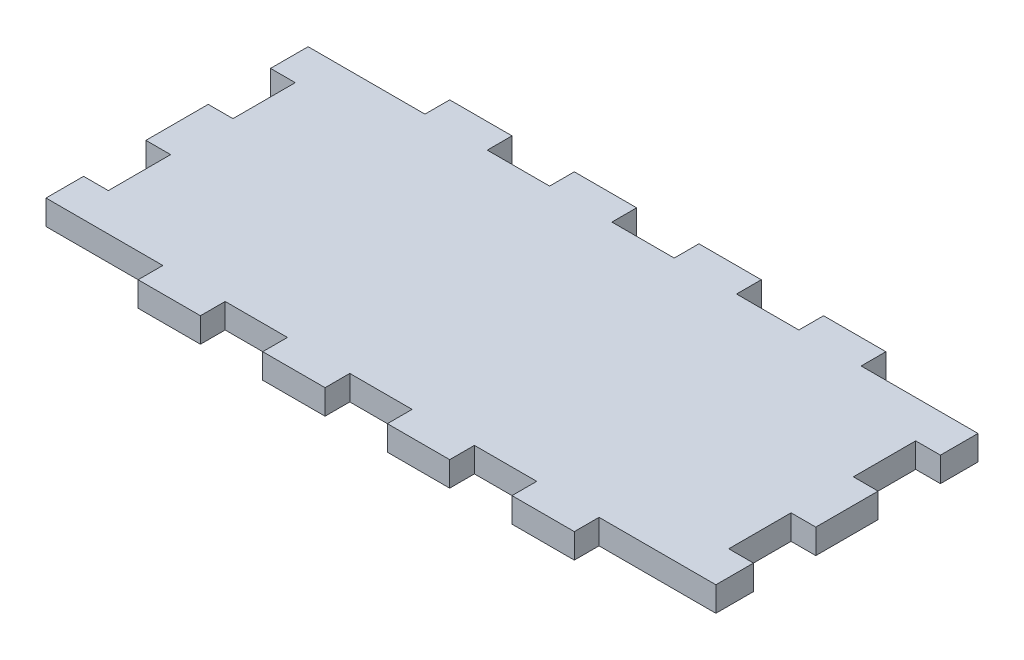
from build123d import *

# Parameters (mm, degrees)
SKETCH1_W           = 86
SKETCH1_H           = 40
BOSS_EXTRUDE1_DEPTH = 3.175
CUT_EXTRUDE1_REACH  = 96.9
SKETCH2_W           = 15
SKETCH2_H           = 3.175
SKETCH2_W_2         = 8
CUT_EXTRUDE2_REACH  = 96.9
SKETCH3_W           = 3.175
SKETCH3_H           = 8


with BuildPart() as part:
    # Sketch1 → Boss-Extrude1 (new body)
    with BuildSketch(Plane(origin=(0, 0, 0), x_dir=(1, 0, 0), z_dir=(0, 1, 0))):
        with Locations((43, -20)):
            Rectangle(SKETCH1_W, SKETCH1_H)
    extrude(amount=BOSS_EXTRUDE1_DEPTH)

    # Sketch2 → Cut-Extrude1 (cut, up to next)
    with BuildSketch(Plane(origin=(0, 3.175, 0), x_dir=(1, 0, 0), z_dir=(0, 1, 0)), mode=Mode.PRIVATE) as cut_extrude1_sk1:
        with Locations((7.5, -1.5875)):
            Rectangle(SKETCH2_W, SKETCH2_H)
    cut_extrude1_tool1 = extrude(cut_extrude1_sk1.sketch, amount=-CUT_EXTRUDE1_REACH, mode=Mode.PRIVATE) & part.part
    # Sketch2 → Cut-Extrude1 (cut, up to next)
    with BuildSketch(Plane(origin=(0, 3.175, 0), x_dir=(1, 0, 0), z_dir=(0, 1, 0)), mode=Mode.PRIVATE) as cut_extrude1_sk2:
        with Locations((43, -1.5875)):
            Rectangle(SKETCH2_W_2, SKETCH2_H)
    cut_extrude1_tool2 = extrude(cut_extrude1_sk2.sketch, amount=-CUT_EXTRUDE1_REACH, mode=Mode.PRIVATE) & part.part
    # Sketch2 → Cut-Extrude1 (cut, up to next)
    with BuildSketch(Plane(origin=(0, 3.175, 0), x_dir=(1, 0, 0), z_dir=(0, 1, 0)), mode=Mode.PRIVATE) as cut_extrude1_sk3:
        with Locations((59, -1.5875)):
            Rectangle(SKETCH2_W_2, SKETCH2_H)
    cut_extrude1_tool3 = extrude(cut_extrude1_sk3.sketch, amount=-CUT_EXTRUDE1_REACH, mode=Mode.PRIVATE) & part.part
    # Sketch2 → Cut-Extrude1 (cut, up to next)
    with BuildSketch(Plane(origin=(0, 3.175, 0), x_dir=(1, 0, 0), z_dir=(0, 1, 0)), mode=Mode.PRIVATE) as cut_extrude1_sk4:
        with Locations((78.5, -1.5875)):
            Rectangle(SKETCH2_W, SKETCH2_H)
    cut_extrude1_tool4 = extrude(cut_extrude1_sk4.sketch, amount=-CUT_EXTRUDE1_REACH, mode=Mode.PRIVATE) & part.part
    # Sketch2 → Cut-Extrude1 (cut, up to next)
    with BuildSketch(Plane(origin=(0, 3.175, 0), x_dir=(1, 0, 0), z_dir=(0, 1, 0)), mode=Mode.PRIVATE) as cut_extrude1_sk5:
        with Locations((27, -1.5875)):
            Rectangle(SKETCH2_W_2, SKETCH2_H)
    cut_extrude1_tool5 = extrude(cut_extrude1_sk5.sketch, amount=-CUT_EXTRUDE1_REACH, mode=Mode.PRIVATE) & part.part
    # Sketch2 → Cut-Extrude1 (cut, up to next)
    with BuildSketch(Plane(origin=(0, 3.175, 0), x_dir=(1, 0, 0), z_dir=(0, 1, 0)), mode=Mode.PRIVATE) as cut_extrude1_sk6:
        with Locations((43, -38.4125)):
            Rectangle(SKETCH2_W_2, SKETCH2_H)
    cut_extrude1_tool6 = extrude(cut_extrude1_sk6.sketch, amount=-CUT_EXTRUDE1_REACH, mode=Mode.PRIVATE) & part.part
    # Sketch2 → Cut-Extrude1 (cut, up to next)
    with BuildSketch(Plane(origin=(0, 3.175, 0), x_dir=(1, 0, 0), z_dir=(0, 1, 0)), mode=Mode.PRIVATE) as cut_extrude1_sk7:
        with Locations((27, -38.4125)):
            Rectangle(SKETCH2_W_2, SKETCH2_H)
    cut_extrude1_tool7 = extrude(cut_extrude1_sk7.sketch, amount=-CUT_EXTRUDE1_REACH, mode=Mode.PRIVATE) & part.part
    # Sketch2 → Cut-Extrude1 (cut, up to next)
    with BuildSketch(Plane(origin=(0, 3.175, 0), x_dir=(1, 0, 0), z_dir=(0, 1, 0)), mode=Mode.PRIVATE) as cut_extrude1_sk8:
        with Locations((7.5, -38.4125)):
            Rectangle(SKETCH2_W, SKETCH2_H)
    cut_extrude1_tool8 = extrude(cut_extrude1_sk8.sketch, amount=-CUT_EXTRUDE1_REACH, mode=Mode.PRIVATE) & part.part
    # Sketch2 → Cut-Extrude1 (cut, up to next)
    with BuildSketch(Plane(origin=(0, 3.175, 0), x_dir=(1, 0, 0), z_dir=(0, 1, 0)), mode=Mode.PRIVATE) as cut_extrude1_sk9:
        with Locations((78.5, -38.4125)):
            Rectangle(SKETCH2_W, SKETCH2_H)
    cut_extrude1_tool9 = extrude(cut_extrude1_sk9.sketch, amount=-CUT_EXTRUDE1_REACH, mode=Mode.PRIVATE) & part.part
    # Sketch2 → Cut-Extrude1 (cut, up to next)
    with BuildSketch(Plane(origin=(0, 3.175, 0), x_dir=(1, 0, 0), z_dir=(0, 1, 0)), mode=Mode.PRIVATE) as cut_extrude1_sk10:
        with Locations((59, -38.4125)):
            Rectangle(SKETCH2_W_2, SKETCH2_H)
    cut_extrude1_tool10 = extrude(cut_extrude1_sk10.sketch, amount=-CUT_EXTRUDE1_REACH, mode=Mode.PRIVATE) & part.part
    add(cut_extrude1_tool1.solids().sort_by_distance((7.5, 3.175, 1.5875))[0], mode=Mode.SUBTRACT)
    add(cut_extrude1_tool2.solids().sort_by_distance((43, 3.175, 1.5875))[0], mode=Mode.SUBTRACT)
    add(cut_extrude1_tool3.solids().sort_by_distance((59, 3.175, 1.5875))[0], mode=Mode.SUBTRACT)
    add(cut_extrude1_tool4.solids().sort_by_distance((78.5, 3.175, 1.5875))[0], mode=Mode.SUBTRACT)
    add(cut_extrude1_tool5.solids().sort_by_distance((27, 3.175, 1.5875))[0], mode=Mode.SUBTRACT)
    add(cut_extrude1_tool6.solids().sort_by_distance((43, 3.175, 38.4125))[0], mode=Mode.SUBTRACT)
    add(cut_extrude1_tool7.solids().sort_by_distance((27, 3.175, 38.4125))[0], mode=Mode.SUBTRACT)
    add(cut_extrude1_tool8.solids().sort_by_distance((7.5, 3.175, 38.4125))[0], mode=Mode.SUBTRACT)
    add(cut_extrude1_tool9.solids().sort_by_distance((78.5, 3.175, 38.4125))[0], mode=Mode.SUBTRACT)
    add(cut_extrude1_tool10.solids().sort_by_distance((59, 3.175, 38.4125))[0], mode=Mode.SUBTRACT)

    # Sketch3 → Cut-Extrude2 (cut, up to next)
    with BuildSketch(Plane(origin=(0, 3.175, 0), x_dir=(1, 0, 0), z_dir=(0, 1, 0)), mode=Mode.PRIVATE) as cut_extrude2_sk1:
        with Locations((1.5875, -28)):
            Rectangle(SKETCH3_W, SKETCH3_H)
    cut_extrude2_tool1 = extrude(cut_extrude2_sk1.sketch, amount=-CUT_EXTRUDE2_REACH, mode=Mode.PRIVATE) & part.part
    # Sketch3 → Cut-Extrude2 (cut, up to next)
    with BuildSketch(Plane(origin=(0, 3.175, 0), x_dir=(1, 0, 0), z_dir=(0, 1, 0)), mode=Mode.PRIVATE) as cut_extrude2_sk2:
        with Locations((1.5875, -12)):
            Rectangle(SKETCH3_W, SKETCH3_H)
    cut_extrude2_tool2 = extrude(cut_extrude2_sk2.sketch, amount=-CUT_EXTRUDE2_REACH, mode=Mode.PRIVATE) & part.part
    # Sketch3 → Cut-Extrude2 (cut, up to next)
    with BuildSketch(Plane(origin=(0, 3.175, 0), x_dir=(1, 0, 0), z_dir=(0, 1, 0)), mode=Mode.PRIVATE) as cut_extrude2_sk3:
        with Locations((84.4125, -28)):
            Rectangle(SKETCH3_W, SKETCH3_H)
    cut_extrude2_tool3 = extrude(cut_extrude2_sk3.sketch, amount=-CUT_EXTRUDE2_REACH, mode=Mode.PRIVATE) & part.part
    # Sketch3 → Cut-Extrude2 (cut, up to next)
    with BuildSketch(Plane(origin=(0, 3.175, 0), x_dir=(1, 0, 0), z_dir=(0, 1, 0)), mode=Mode.PRIVATE) as cut_extrude2_sk4:
        with Locations((84.4125, -12)):
            Rectangle(SKETCH3_W, SKETCH3_H)
    cut_extrude2_tool4 = extrude(cut_extrude2_sk4.sketch, amount=-CUT_EXTRUDE2_REACH, mode=Mode.PRIVATE) & part.part
    add(cut_extrude2_tool1.solids().sort_by_distance((1.5875, 3.175, 28))[0], mode=Mode.SUBTRACT)
    add(cut_extrude2_tool2.solids().sort_by_distance((1.5875, 3.175, 12))[0], mode=Mode.SUBTRACT)
    add(cut_extrude2_tool3.solids().sort_by_distance((84.4125, 3.175, 28))[0], mode=Mode.SUBTRACT)
    add(cut_extrude2_tool4.solids().sort_by_distance((84.4125, 3.175, 12))[0], mode=Mode.SUBTRACT)


solid = part.part
